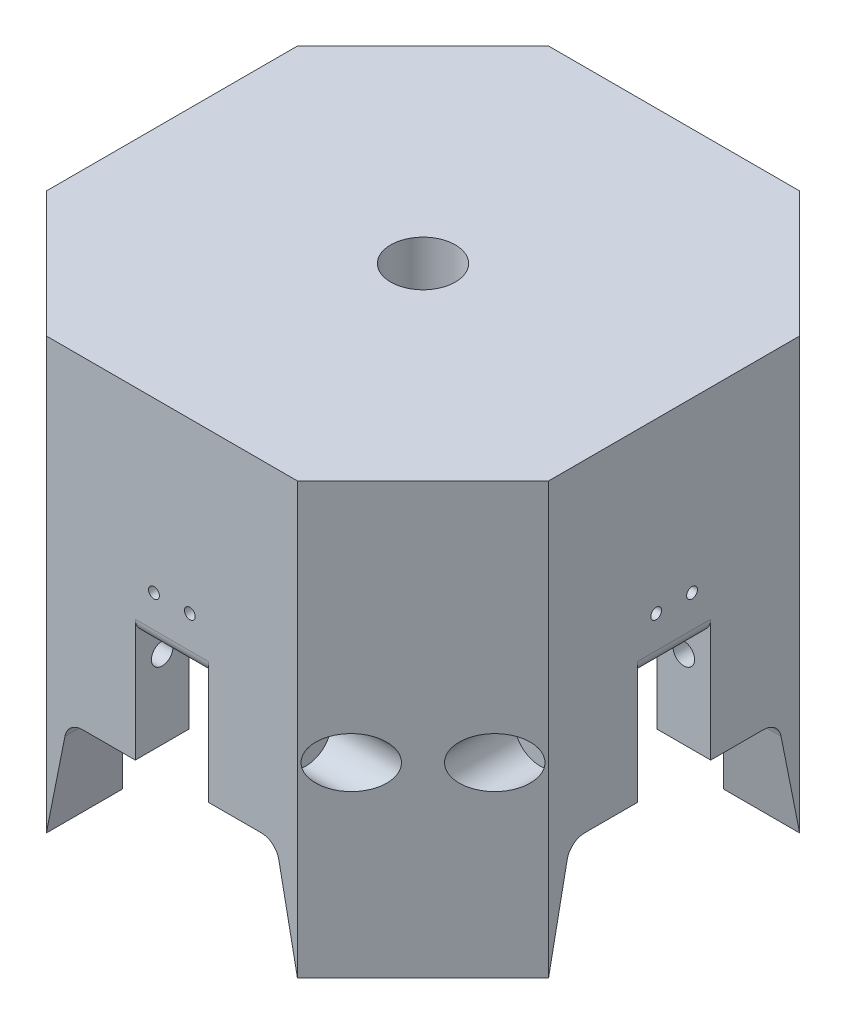
from build123d import *

# Parameters (mm, degrees)
BOSS_EXTRUDE2_DEPTH      = 60
SHELL2_T                 = -7.5
SKETCH14_R               = 4.5
CUT_EXTRUDE3_DEPTH       = 7.5
SKETCH24_W               = 10.2
SKETCH24_H               = 7.5
CUT_EXTRUDE14_DEPTH      = 30
SKETCH20_R               = 1.5
CUT_EXTRUDE15_DEPTH      = 9.9
CUT_EXTRUDE16_REACH      = 87.586
SKETCH20_5_R             = 3.5
CIRPATTERN20_COUNT       = 4
CIRPATTERN21_START       = -24.7500001
CIRPATTERN21_OUTLINE_R   = 3.5
CIRPATTERN21_DEPTH       = 9.7500001
CIRPATTERN21_START_2     = 15
CIRPATTERN21_2_OUTLINE_R = 3.5
CIRPATTERN21_2_DEPTH     = 9.7500001
CIRPATTERN21_START_3     = -15
CIRPATTERN21_3_OUTLINE_R = 1.5
CIRPATTERN21_3_DEPTH     = 30
CIRPATTERN21_4_OUTLINE_R = 3.5
CIRPATTERN21_4_DEPTH     = 9.7500001
CIRPATTERN21_5_OUTLINE_R = 3.5
CIRPATTERN21_5_DEPTH     = 9.7500001
CIRPATTERN21_6_OUTLINE_R = 1.5
CIRPATTERN21_6_DEPTH     = 30
FILLET1_R                = 2
CUT_EXTRUDE17_REACH      = 100.615
SKETCH30_R               = 0.752022917
CUT_EXTRUDE19_START      = -10.606601718
CUT_EXTRUDE19_DEPTH      = 10.606601718
CIRPATTERN30_COUNT       = 4
FILLET4_R                = 2.5


# Read off the part's stored shape, not the designer's step: CirPattern21, Cut-Extrude19
with BuildPart() as part:
    # Sketch11 → Boss-Extrude2 (new body)
    with BuildSketch(Plane(origin=(0, 0, 0), x_dir=(1, 0, 0), z_dir=(0, 1, 0))):
        Polygon((17.5, 35), (0, 35), (-17.5, 35), (-35, 17.5), (-35, 0), (-35, -17.5), (-17.5, -35), (0, -35), (17.5, -35), (35, -17.5), (35, 0), (35, 17.5), align=None)
    extrude(amount=BOSS_EXTRUDE2_DEPTH)

    # Shell2
    shell2_openings = [part.faces().sort_by_distance(p)[0] for p in [
        (0, 0, 0),
    ]]
    offset(amount=SHELL2_T, openings=shell2_openings, kind=Kind.INTERSECTION)

    # Sketch14 → Cut-Extrude3 (cut)
    with BuildSketch(Plane(origin=(0, 60, 0), x_dir=(1, 0, 0), z_dir=(0, 1, 0))):
        with Locations(Location((0, 0, 0), (0, 0, 270))):
            Circle(SKETCH14_R)
    extrude(amount=-CUT_EXTRUDE3_DEPTH, mode=Mode.SUBTRACT)

    # Sketch24 → Cut-Extrude14 (cut)
    with BuildSketch(Plane.XZ):
        with Locations((0, 31.25)):
            Rectangle(SKETCH24_W, SKETCH24_H)
    cut_extrude14 = extrude(amount=-CUT_EXTRUDE14_DEPTH, mode=Mode.SUBTRACT)

    # Sketch20 → Cut-Extrude15 (cut)
    with BuildSketch(Plane(origin=(15, 0, 0), x_dir=(0, 0, -1), z_dir=(1, 0, 0))):
        with Locations((-31.25, 26)):
            Circle(SKETCH20_R)
    cut_extrude15 = extrude(amount=-CUT_EXTRUDE15_DEPTH, mode=Mode.SUBTRACT)

    # Cut-Extrude16: up to this plane
    cut_extrude16_end = Plane(origin=(26.25, 60, 26.25), z_dir=(-0.7071067811864445, 0, -0.7071067811866506))
    # Sketch20<5> → Cut-Extrude16 (cut, up to the surface)
    with BuildSketch(Plane(origin=(15, 0, 0), x_dir=(0, 0, -1), z_dir=(1, 0, 0)), mode=Mode.PRIVATE) as cut_extrude16_sk1:
        with Locations(Location((-31.25, 26, 0), (0, 0, 180))):
            Circle(SKETCH20_5_R)
    cut_extrude16_tool1 = split(extrude(cut_extrude16_sk1.sketch, amount=CUT_EXTRUDE16_REACH, mode=Mode.PRIVATE), bisect_by=cut_extrude16_end, keep=Keep.BOTH, mode=Mode.PRIVATE)
    cut_extrude16 = cut_extrude16_tool1.solids().sort_by_distance((15, 26, 31.25))[0]
    add(cut_extrude16, mode=Mode.SUBTRACT)

    # Mirror2: Cut-Extrude15, Cut-Extrude16 across plane
    add(cut_extrude15.mirror(Plane(origin=(0, 0, 0), x_dir=(0, 0, 1), z_dir=(1, 0, 0))), mode=Mode.SUBTRACT)
    add(cut_extrude16.mirror(Plane(origin=(0, 0, 0), x_dir=(0, 0, 1), z_dir=(1, 0, 0))), mode=Mode.SUBTRACT)

    # CirPattern20: Cut-Extrude14 ×4 about axis
    cirpattern20_axis = Axis((0, 0, 0), (0, 1, 0))
    for i in range(1, CIRPATTERN20_COUNT):
        add(cut_extrude14.rotate(cirpattern20_axis, i * 360 / CIRPATTERN20_COUNT), mode=Mode.SUBTRACT)

    # CirPattern21 outline → CirPattern21 (cut)
    with BuildSketch(Plane.YZ.offset(CIRPATTERN21_START)):
        with Locations((26, -31.25)):
            Circle(CIRPATTERN21_OUTLINE_R)
    extrude(amount=CIRPATTERN21_DEPTH, mode=Mode.SUBTRACT)

    # CirPattern21 2 outline → CirPattern21 2 (cut)
    with BuildSketch(Plane.YZ.offset(CIRPATTERN21_START_2)):
        with Locations((26, -31.25)):
            Circle(CIRPATTERN21_2_OUTLINE_R)
    extrude(amount=CIRPATTERN21_2_DEPTH, mode=Mode.SUBTRACT)

    # CirPattern21 3 outline → CirPattern21 3 (cut)
    with BuildSketch(Plane.YZ.offset(CIRPATTERN21_START_3)):
        with Locations((26, -31.25)):
            Circle(CIRPATTERN21_3_OUTLINE_R)
    extrude(amount=CIRPATTERN21_3_DEPTH, mode=Mode.SUBTRACT)

    # CirPattern21 4 outline → CirPattern21 4 (cut)
    with BuildSketch(Plane.XY.offset(CIRPATTERN21_START)):
        with Locations((-31.25, 26)):
            Circle(CIRPATTERN21_4_OUTLINE_R)
        with Locations((31.25, 26)):
            Circle(CIRPATTERN21_4_OUTLINE_R)
    extrude(amount=CIRPATTERN21_4_DEPTH, mode=Mode.SUBTRACT)

    # CirPattern21 5 outline → CirPattern21 5 (cut)
    with BuildSketch(Plane.XY.offset(CIRPATTERN21_START_2)):
        with Locations((-31.25, 26)):
            Circle(CIRPATTERN21_5_OUTLINE_R)
        with Locations((31.25, 26)):
            Circle(CIRPATTERN21_5_OUTLINE_R)
    extrude(amount=CIRPATTERN21_5_DEPTH, mode=Mode.SUBTRACT)

    # CirPattern21 6 outline → CirPattern21 6 (cut)
    with BuildSketch(Plane.XY.offset(CIRPATTERN21_START_3)):
        with Locations((-31.25, 26)):
            Circle(CIRPATTERN21_6_OUTLINE_R)
        with Locations((31.25, 26)):
            Circle(CIRPATTERN21_6_OUTLINE_R)
    extrude(amount=CIRPATTERN21_6_DEPTH, mode=Mode.SUBTRACT)

    # Fillet1
    fillet1_edges = [part.edges().sort_by_distance(p)[0] for p in [
        (-27.5, 30, 0),
        (-35, 30, 0),
        (0, 30, -27.5),
        (0, 30, -35),
        (27.5, 30, 0),
        (35, 30, 0),
        (0, 30, 27.5),
        (0, 30, 35),
    ]]
    fillet(fillet1_edges, radius=FILLET1_R)

    # Sketch30 → Cut-Extrude17 (cut, up to next)
    with BuildSketch(Plane.XY.offset(35), mode=Mode.PRIVATE) as cut_extrude17_sk1:
        with Locations((2.5, 36.5)):
            Circle(SKETCH30_R)
    cut_extrude17_tool1 = extrude(cut_extrude17_sk1.sketch, amount=-CUT_EXTRUDE17_REACH, mode=Mode.PRIVATE) & part.part
    # Sketch30 → Cut-Extrude17 (cut, up to next)
    with BuildSketch(Plane.XY.offset(35), mode=Mode.PRIVATE) as cut_extrude17_sk2:
        with Locations(Location((-2.5, 36.5, 0), (0, 0, 180))):
            Circle(SKETCH30_R)
    cut_extrude17_tool2 = extrude(cut_extrude17_sk2.sketch, amount=-CUT_EXTRUDE17_REACH, mode=Mode.PRIVATE) & part.part
    cut_extrude17_1 = cut_extrude17_tool1.solids().sort_by_distance((2.5, 36.5, 35))[0]
    add(cut_extrude17_1, mode=Mode.SUBTRACT)
    cut_extrude17_2 = cut_extrude17_tool2.solids().sort_by_distance((-2.5, 36.5, 35))[0]
    add(cut_extrude17_2, mode=Mode.SUBTRACT)
    cut_extrude17 = cut_extrude17_1 + cut_extrude17_2  # Cut-Extrude17 as one shape, for the pattern or mirror that repeats it

    # Cut-Extrude19 outline → Cut-Extrude19 (cut)
    with BuildSketch(Plane(origin=(35, 0, 0), x_dir=(0, 0, -1), z_dir=(1, 0, 0)).offset(CUT_EXTRUDE19_START)):
        Polygon((17.5, 0), (14.5, 15), (5.1, 15), (5.1, 0), align=None)
        Polygon((-5.1, 0), (-5.1, 15), (-14.5, 15), (-17.5, 0), align=None)
    cut_extrude19 = extrude(amount=CUT_EXTRUDE19_DEPTH, mode=Mode.SUBTRACT)

    # CirPattern30: Cut-Extrude17, Cut-Extrude19 ×4 about axis
    cirpattern30_axis = Axis((0, 0, 0), (0, 1, 0))
    add([cut_extrude17.rotate(cirpattern30_axis, i * 360 / CIRPATTERN30_COUNT) for i in range(1, CIRPATTERN30_COUNT)], mode=Mode.SUBTRACT)
    add([cut_extrude19.rotate(cirpattern30_axis, i * 360 / CIRPATTERN30_COUNT) for i in range(1, CIRPATTERN30_COUNT)], mode=Mode.SUBTRACT)

    # Fillet4
    fillet4_edges = [part.edges().sort_by_distance(p)[0] for p in [
        (31.196699141, 15, -14.5),
        (31.196699141, 15, 14.5),
        (14.5, 15, -31.196699141),
        (-14.5, 15, -31.196699141),
        (-31.196699141, 15, -14.5),
        (-31.196699141, 15, 14.5),
        (-14.5, 15, 31.196699141),
        (14.5, 15, 31.196699141),
    ]]
    fillet(fillet4_edges, radius=FILLET4_R)


solid = part.part
